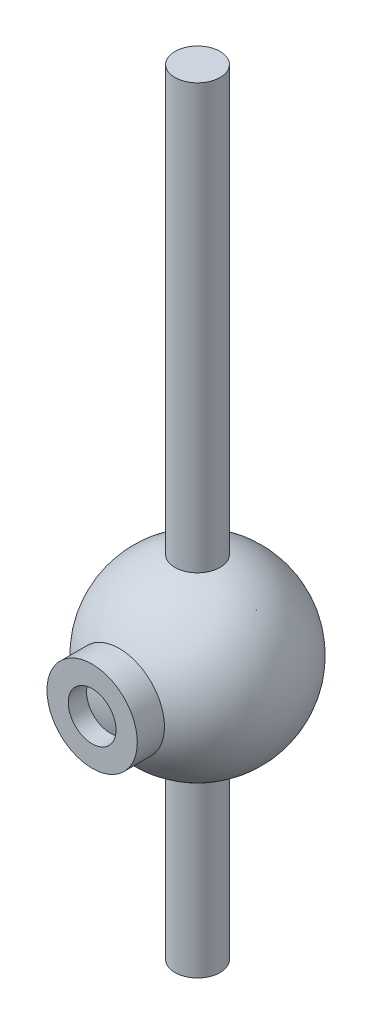
from build123d import *

# Parameters (mm, degrees)
BOSS_EXTRUDE1_START = 7
SKETCH1_R           = 6
SKETCH1_R_2         = 3.175
BOSS_EXTRUDE1_DEPTH = 7
REVOLVE1_ANGLE      = 359.999695921


with BuildPart() as part:
    # Sketch1 → Boss-Extrude1 (new body)
    with BuildSketch(Plane.XY.offset(BOSS_EXTRUDE1_START)):
        Circle(SKETCH1_R)
        Circle(SKETCH1_R_2, mode=Mode.SUBTRACT)
    extrude(amount=BOSS_EXTRUDE1_DEPTH)

    # Sketch2 → Revolve1 (revolve)
    with BuildSketch(Plane.XY):
        with BuildLine():
            Line((0, -35), (3, -35))
            Line((3, -35), (3, -11.618950039))
            ThreePointArc((3, -11.618950039), (12, 0), (3, 11.618950039))
            Line((3, 11.618950039), (3, 68))
            Line((3, 68), (0, 68))
            Line((0, 68), (0, -35))
        make_face()
    revolve(axis=Axis((0, -35, 0), (0, 1, 0)), revolution_arc=REVOLVE1_ANGLE)


solid = part.part
